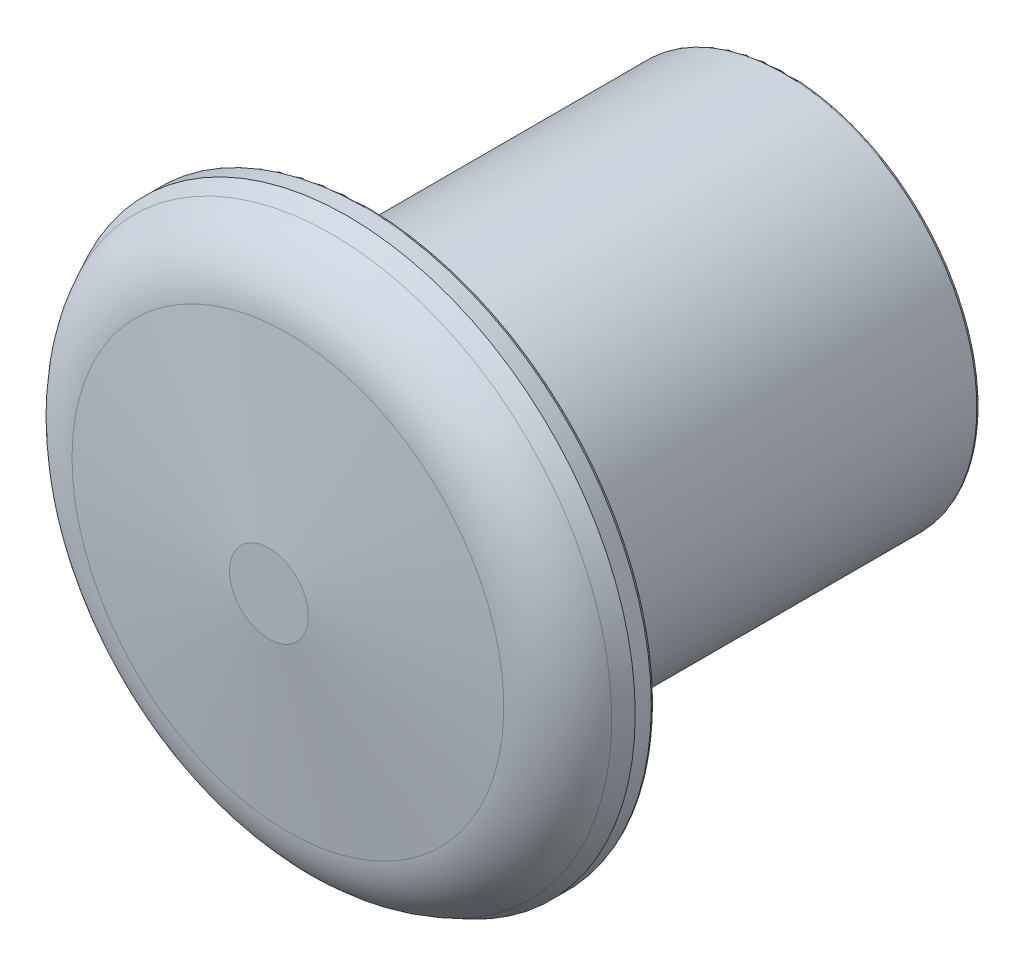
from build123d import *

# Parameters (mm, degrees)
FILLET3_R = 0.1
FILLET4_R = 0.1


with BuildPart() as part:
    # Sketch1 → Revolve2 (revolve)
    with BuildSketch(Plane(origin=(0, 0, 0), x_dir=(0, 0, -1), z_dir=(1, 0, 0))):
        with BuildLine():
            Line((2.397152395, 10.655987944), (3, 10.95))
            Line((3, 10.95), (3.712206696, 10.95))
            Line((3.712206696, 10.95), (3.712206696, 8.9))
            Line((3.712206696, 8.9), (4.712206696, 8.9))
            Line((4.712206696, 8.9), (4.712206696, 7.35))
            Line((4.712206696, 7.35), (19.712206696, 7.35))
            Line((19.712206696, 7.35), (19.712206696, 6.35))
            Line((19.712206696, 6.35), (3, 6.35))
            Line((3, 6.35), (1.882509958, 6.35))
            Line((1.882509958, 6.35), (1.882509958, 0))
            Line((1.882509958, 0), (0, 0))
            Line((0, 0), (0, 1.5))
            Line((0, 1.5), (0.723761069, 8.222622081))
            ThreePointArc((0.723761069, 8.222622081), (1.240295439, 9.659475411), (2.397152395, 10.655987944))
        make_face()
    revolve(axis=Axis((0, 0, -1.882509958), (0, 0, 1)))

    # Fillet3
    fillet3_edges = [part.edges().sort_by_distance(p)[0] for p in [
        (0, -10.95, -3.712206696),
        (0, -8.9, -4.712206696),
        (0, -7.35, -19.712206696),
    ]]
    fillet(fillet3_edges, radius=FILLET3_R)

    # Fillet4
    fillet4_edges = [part.edges().sort_by_distance(p)[0] for p in [
        (0, -6.35, -19.712206696),
    ]]
    fillet(fillet4_edges, radius=FILLET4_R)


solid = part.part
